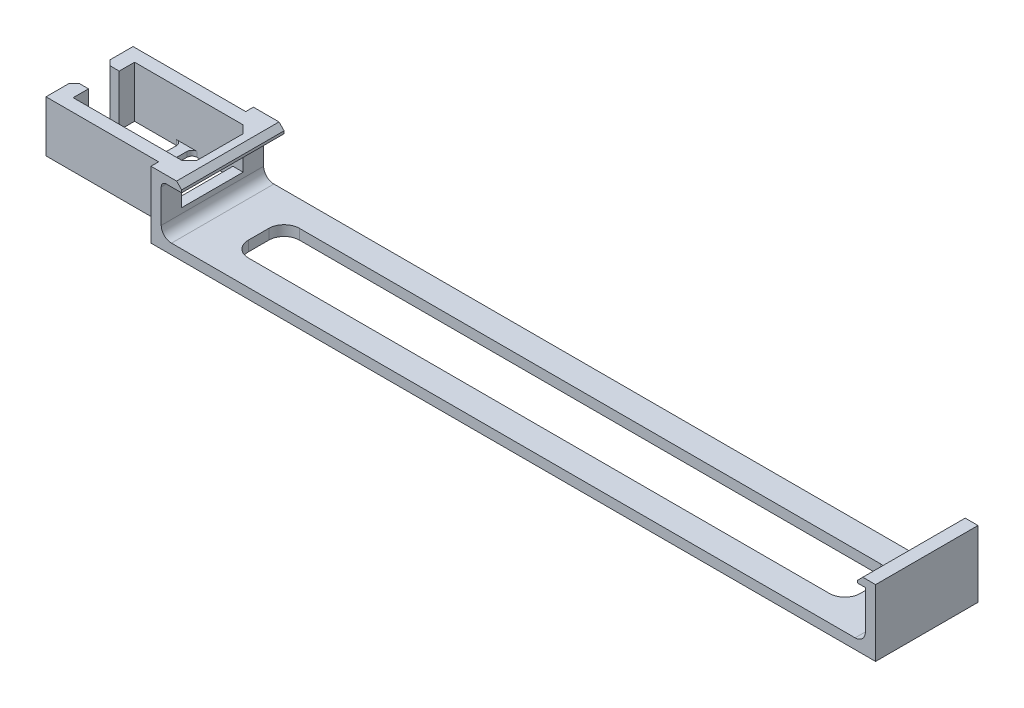
from build123d import *

# Parameters (mm, degrees)
SKETCH1_W               = 141.5
SKETCH1_H               = 20
BOSS_EXTRUDE1_DEPTH     = 2
SKETCH2_W               = 2
SKETCH2_H               = 20
BOSS_EXTRUDE2_DEPTH     = 11
SKETCH3_W               = 20
SKETCH3_H               = 1.5
BOSS_EXTRUDE3_DEPTH     = 1.5
CHAMFER1_SIZE           = 1
SKETCH4_W               = 20
SKETCH4_H               = 1.5
BOSS_EXTRUDE4_DEPTH     = 4
CHAMFER2_SIZE           = 1
CUT_EXTRUDE1_DEPTH      = 1.5
CUT_EXTRUDE1_DEPTH_BACK = 11.5
SKETCH5_W               = 12
SKETCH5_H               = 14.324896111
SKETCH6_W               = 2.5
SKETCH6_H               = 10
BOSS_EXTRUDE5_DEPTH     = 22
SKETCH7_W               = 2.8
SKETCH7_H               = 10
BOSS_EXTRUDE6_DEPTH     = 3
SKETCH8_W               = 2.8
SKETCH8_H               = 10
BOSS_EXTRUDE7_DEPTH     = 3
CHAMFER3_SIZE           = 1
SKETCH9_W               = 2
SKETCH9_H               = 17
BOSS_EXTRUDE8_DEPTH     = 1
FILLET1_R               = 1
FILLET2_R               = 2
SKETCH11_W              = 119.5
SKETCH11_H              = 10
CUT_EXTRUDE2_DEPTH      = 10
FILLET3_R               = 3
CHAMFER4_SIZE           = 1.5
FILLET4_R               = 1


with BuildPart() as part:
    # Sketch1 → Boss-Extrude1 (new body)
    with BuildSketch(Plane(origin=(0, 0, 0), x_dir=(1, 0, 0), z_dir=(0, 1, 0))):
        Rectangle(SKETCH1_W, SKETCH1_H)
    extrude(amount=BOSS_EXTRUDE1_DEPTH)

    # Sketch2 → Boss-Extrude2 (add)
    with BuildSketch(Plane(origin=(0, 2, 0), x_dir=(1, 0, 0), z_dir=(0, 1, 0))):
        with Locations((69.75, 0)):
            Rectangle(SKETCH2_W, SKETCH2_H)
        with Locations((-69.75, 0)):
            Rectangle(SKETCH2_W, SKETCH2_H)
    extrude(amount=BOSS_EXTRUDE2_DEPTH)

    # Sketch3 → Boss-Extrude3 (add)
    with BuildSketch(Plane.ZY.offset(-68.75)):
        with Locations((0, 12.25)):
            Rectangle(SKETCH3_W, SKETCH3_H)
    extrude(amount=BOSS_EXTRUDE3_DEPTH)

    # Chamfer1
    chamfer1_edges = [part.edges().sort_by_distance(p)[0] for p in [
        (67.25, 13, 0),
    ]]
    chamfer(chamfer1_edges, length=CHAMFER1_SIZE)

    # Sketch4 → Boss-Extrude4 (add)
    with BuildSketch(Plane(origin=(-68.75, 0, 0), x_dir=(0, 0, -1), z_dir=(1, 0, 0))):
        with Locations((0, 12.25)):
            Rectangle(SKETCH4_W, SKETCH4_H)
    extrude(amount=BOSS_EXTRUDE4_DEPTH)

    # Chamfer2
    chamfer2_edges = [part.edges().sort_by_distance(p)[0] for p in [
        (-64.75, 13, 0),
    ]]
    chamfer(chamfer2_edges, length=CHAMFER2_SIZE)

    # Sketch5 → Cut-Extrude1 (cut, two sides: drawn at the far end of the back side and taken through both)
    with BuildSketch(Plane(origin=(-68.75, 0, 0), x_dir=(0, 0, -1), z_dir=(1, 0, 0)).offset(-CUT_EXTRUDE1_DEPTH_BACK)):
        with Locations((0, 12.162448056)):
            Rectangle(SKETCH5_W, SKETCH5_H)
    extrude(amount=CUT_EXTRUDE1_DEPTH + CUT_EXTRUDE1_DEPTH_BACK, mode=Mode.SUBTRACT)

    # Sketch6 → Boss-Extrude5 (add)
    with BuildSketch(Plane.ZY.offset(70.75)):
        with Locations((-7.25, 8)):
            Rectangle(SKETCH6_W, SKETCH6_H)
        with Locations((7.25, 8)):
            Rectangle(SKETCH6_W, SKETCH6_H)
    extrude(amount=BOSS_EXTRUDE5_DEPTH)

    # Sketch7 → Boss-Extrude6 (add)
    with BuildSketch(Plane(origin=(0, 0, 6), x_dir=(-1, 0, 0), z_dir=(0, 0, -1))):
        with Locations((91.35, 8)):
            Rectangle(SKETCH7_W, SKETCH7_H)
    extrude(amount=BOSS_EXTRUDE6_DEPTH)

    # Sketch8 → Boss-Extrude7 (add)
    with BuildSketch(Plane.XY.offset(-6)):
        with Locations((-91.35, 8)):
            Rectangle(SKETCH8_W, SKETCH8_H)
    extrude(amount=BOSS_EXTRUDE7_DEPTH)

    # Chamfer3
    chamfer3_edges = [part.edges().sort_by_distance(p)[0] for p in [
        (-92.75, 8, -3),
        (-92.75, 8, 3),
    ]]
    chamfer(chamfer3_edges, length=CHAMFER3_SIZE)

    # Sketch9 → Boss-Extrude8 (add)
    with BuildSketch(Plane.XZ.offset(-3)):
        with Locations((-79.75, 0)):
            Rectangle(SKETCH9_W, SKETCH9_H)
    extrude(amount=-BOSS_EXTRUDE8_DEPTH)

    # Fillet1
    fillet1_edges = [part.edges().sort_by_distance(p)[0] for p in [
        (-80.75, 3.5, -6),
        (-78.75, 3.5, -6),
        (-80.75, 3.5, 6),
        (-78.75, 3.5, 6),
    ]]
    fillet(fillet1_edges, radius=FILLET1_R)

    # Fillet2
    fillet2_edges = [part.edges().sort_by_distance(p)[0] for p in [
        (-68.75, 2, 0),
        (68.75, 2, 0),
    ]]
    fillet(fillet2_edges, radius=FILLET2_R)

    # Sketch11 → Cut-Extrude2 (cut)
    with BuildSketch(Plane(origin=(0, 2, 0), x_dir=(1, 0, 0), z_dir=(0, 1, 0))):
        Rectangle(SKETCH11_W, SKETCH11_H)
    extrude(amount=-CUT_EXTRUDE2_DEPTH, mode=Mode.SUBTRACT)

    # Fillet3
    fillet3_edges = [part.edges().sort_by_distance(p)[0] for p in [
        (59.75, 1, 5),
        (59.75, 1, -5),
        (-59.75, 1, 5),
        (-59.75, 1, -5),
    ]]
    fillet(fillet3_edges, radius=FILLET3_R)

    # Chamfer4
    chamfer4_edges = [part.edges().sort_by_distance(p)[0] for p in [
        (-67.25, 12.25, 6),
        (-67.25, 12.25, -6),
    ]]
    chamfer(chamfer4_edges, length=CHAMFER4_SIZE)

    # Fillet4
    fillet4_edges = [part.edges().sort_by_distance(p)[0] for p in [
        (-68.75, 11.5, 8),
        (-68.75, 11.5, -8),
    ]]
    fillet(fillet4_edges, radius=FILLET4_R)


solid = part.part
